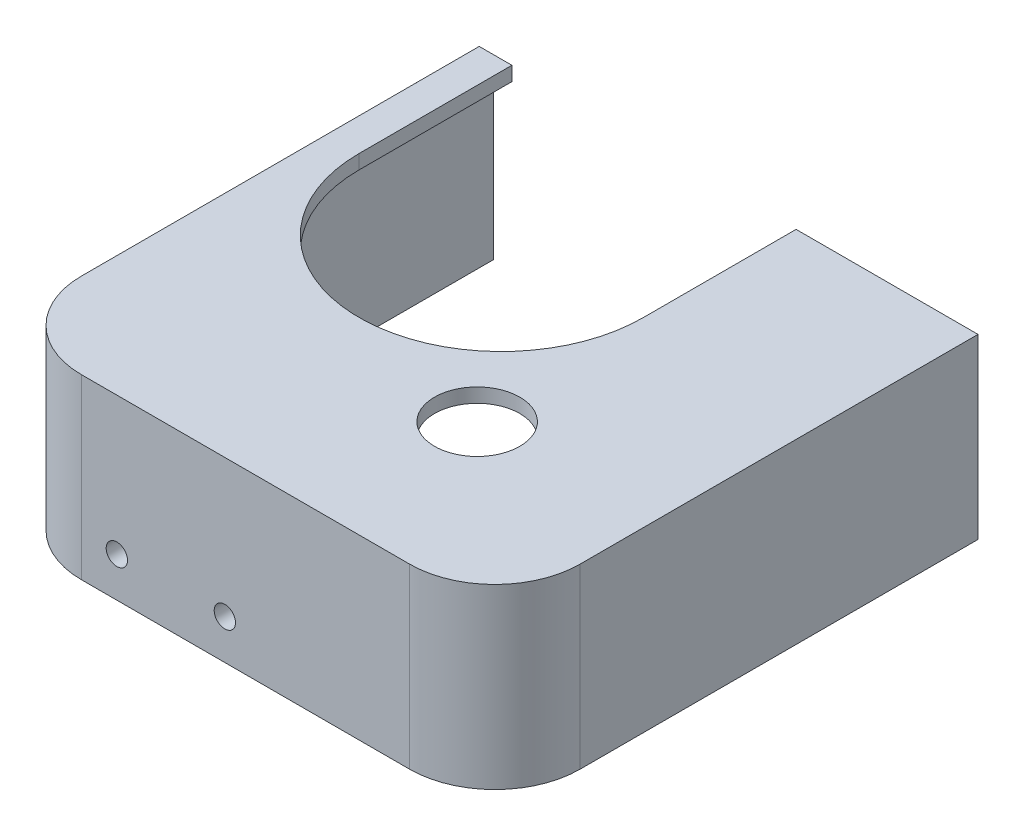
from build123d import *

# Parameters (mm, degrees)
SKETCH1_W             = 4.399513203
SKETCH1_H             = 6
SKETCH1_R             = 0.75
BOSS_EXTRUDE1_DEPTH   = 1.5
BOSS_EXTRUDE1_2_DEPTH = 1.5
BOSS_EXTRUDE2_START   = -1
SKETCH2_W             = 34.1
SKETCH2_H             = 12.5
SKETCH2_R             = 0.75
BOSS_EXTRUDE2_DEPTH   = 1
BOSS_EXTRUDE3_DEPTH   = 1
SKETCH5_W             = 34
SKETCH5_H             = 12.5
BOSS_EXTRUDE4_DEPTH   = 1
SKETCH6_W             = 34
SKETCH6_H             = 12.5
BOSS_EXTRUDE5_DEPTH   = 1
SKETCH7_W             = 3.200973594
SKETCH7_H             = 6
BOSS_EXTRUDE6_DEPTH   = 2
FILLET1_R             = 2
FILLET2_R             = 5
FILLET3_R             = 6
FILLET4_R             = 5
FILLET5_R             = 6
SKETCH8_R             = 3
CUT_EXTRUDE1_DEPTH    = 2
FILLET1_OF_MIRROR1_R  = 2
FILLET2_OF_MIRROR1_R  = 5
FILLET3_OF_MIRROR1_R  = 6
FILLET4_OF_MIRROR1_R  = 5
FILLET5_OF_MIRROR1_R  = 6
CUT_EXTRUDE2_START    = -10.5
CUT_EXTRUDE2_DEPTH    = 10.5
CUT_EXTRUDE4_START    = -1
CUT_EXTRUDE4_DEPTH    = 1


with BuildPart() as part:
    # Sketch1 → Boss-Extrude1 (new body)
    with BuildSketch(Plane.XY):
        with Locations((-6.699756601, -5)):
            Rectangle(SKETCH1_W, SKETCH1_H)
        with Locations((-6.7, -4.8)):
            Circle(SKETCH1_R, mode=Mode.SUBTRACT)
    boss_extrude1 = extrude(amount=BOSS_EXTRUDE1_DEPTH)



with BuildPart() as body_2:
    # Sketch1 → Boss-Extrude1 2 (new body)
    with BuildSketch(Plane.XY):
        with Locations((-14.300243399, -5)):
            Rectangle(SKETCH1_W, SKETCH1_H)
        with Locations((-14.3, -4.8)):
            Circle(SKETCH1_R, mode=Mode.SUBTRACT)
    boss_extrude1_2 = extrude(amount=BOSS_EXTRUDE1_2_DEPTH)


with BuildPart() as part_1:
    add(part.part)

    add(body_2.part)  # Boss-Extrude2 merges body 2
    # Sketch2 → Boss-Extrude2 (add)
    with BuildSketch(Plane.XY.offset(1.5).offset(BOSS_EXTRUDE2_START)):
        with Locations((-4.75, -8.25)):
            Rectangle(SKETCH2_W, SKETCH2_H)
        with Locations((-6.7, -4.8)):
            Circle(SKETCH2_R, mode=Mode.SUBTRACT)
        with Locations((-14.3, -4.8)):
            Circle(SKETCH2_R, mode=Mode.SUBTRACT)
    boss_extrude2 = extrude(amount=BOSS_EXTRUDE2_DEPTH)

    # Sketch4 → Boss-Extrude3 (add)
    with BuildSketch(Plane.XZ.offset(14.5)):
        with BuildLine():
            Line((-21.8, 0.5), (-21.8, -32.5))
            Line((-21.8, -32.5), (-20.5, -32.5))
            Line((-20.5, -32.5), (-20.5, -21.75))
            ThreePointArc((-20.5, -21.75), (-10.5, -11.75), (-0.5, -21.75))
            Line((-0.5, -21.75), (-0.5, -32.5))
            Line((-0.5, -32.5), (12.3, -32.5))
            Line((12.3, -32.5), (12.3, 0.5))
            Line((12.3, 0.5), (-21.8, 0.5))
        make_face()
    boss_extrude3 = extrude(amount=-BOSS_EXTRUDE3_DEPTH)

    # Sketch5 → Boss-Extrude4 (add)
    with BuildSketch(Plane.ZY.offset(21.8)):
        with Locations((-15.5, -8.25)):
            Rectangle(SKETCH5_W, SKETCH5_H)
    boss_extrude4 = extrude(amount=BOSS_EXTRUDE4_DEPTH)

    # Sketch6 → Boss-Extrude5 (add)
    with BuildSketch(Plane(origin=(12.3, 0, 0), x_dir=(0, 0, -1), z_dir=(1, 0, 0))):
        with Locations((15.5, -8.25)):
            Rectangle(SKETCH6_W, SKETCH6_H)
    boss_extrude5 = extrude(amount=-BOSS_EXTRUDE5_DEPTH)

    # Sketch7 → Boss-Extrude6 (add)
    with BuildSketch(Plane(origin=(0, 0, 0.5), x_dir=(-1, 0, 0), z_dir=(0, 0, -1))):
        with Locations((10.5, -5)):
            Rectangle(SKETCH7_W, SKETCH7_H)
    boss_extrude6 = extrude(amount=BOSS_EXTRUDE6_DEPTH)

    # Fillet1
    # the kernel refuses this fillet: 2 mm, written as the material it adds along each edge
    with BuildSketch(Plane(origin=(-16.5, -8, 0.5), x_dir=(0, 0, -1), z_dir=(1, 0, 0))) as fillet1_piece_1_section:
        with BuildLine():
            CenterArc((FILLET1_R, -FILLET1_R), FILLET1_R, 90, 90)
            Line((0, -FILLET1_R), (0, 0))
            Line((0, 0), (FILLET1_R, 0))
        make_face()
    fillet1_piece_1 = extrude(amount=12, mode=Mode.PRIVATE)
    fillet1_piece_1 = split(fillet1_piece_1, bisect_by=Plane(origin=(-14.300243398, -8.620266002, 0), z_dir=(0, 0, 1)), keep=Keep.TOP, mode=Mode.PRIVATE)
    fillet1_piece_1 = split(fillet1_piece_1, bisect_by=Plane(origin=(-12.100486797, -8.620266002, 0.317331321), z_dir=(-1, 0, 0)), keep=Keep.TOP, mode=Mode.PRIVATE)
    add(fillet1_piece_1)
    with BuildSketch(Plane(origin=(-16.5, -8, 0.5), x_dir=(0, 0, -1), z_dir=(1, 0, 0))) as fillet1_piece_2_section:
        with BuildLine():
            CenterArc((FILLET1_R, -FILLET1_R), FILLET1_R, 90, 90)
            Line((0, -FILLET1_R), (0, 0))
            Line((0, 0), (FILLET1_R, 0))
        make_face()
    fillet1_piece_2 = extrude(amount=12, mode=Mode.PRIVATE)
    fillet1_piece_2 = split(fillet1_piece_2, bisect_by=Plane(origin=(-8.899513203, -8.160707913, -0.423889575), z_dir=(-1, 0, 0)), keep=Keep.TOP, mode=Mode.PRIVATE)
    fillet1_piece_2 = split(fillet1_piece_2, bisect_by=Plane(origin=(-10.5, -8.160707913, 0), z_dir=(0, 0, -1)), keep=Keep.TOP, mode=Mode.PRIVATE)
    fillet1_piece_2 = split(fillet1_piece_2, bisect_by=Plane(origin=(-12.100486797, -8.160707913, -0.423889575), z_dir=(1, 0, 0)), keep=Keep.TOP, mode=Mode.PRIVATE)
    add(fillet1_piece_2)
    with BuildSketch(Plane(origin=(-16.5, -8, 0.5), x_dir=(0, 0, -1), z_dir=(1, 0, 0))) as fillet1_piece_3_section:
        with BuildLine():
            CenterArc((FILLET1_R, -FILLET1_R), FILLET1_R, 90, 90)
            Line((0, -FILLET1_R), (0, 0))
            Line((0, 0), (FILLET1_R, 0))
        make_face()
    fillet1_piece_3 = extrude(amount=12, mode=Mode.PRIVATE)
    fillet1_piece_3 = split(fillet1_piece_3, bisect_by=Plane(origin=(-8.899513203, -8.620266002, 0.317331321), z_dir=(-1, 0, 0)), keep=Keep.TOP, mode=Mode.PRIVATE)
    fillet1_piece_3 = split(fillet1_piece_3, bisect_by=Plane(origin=(-10.5, -8.620266002, 0), z_dir=(0, 0, 1)), keep=Keep.TOP, mode=Mode.PRIVATE)
    fillet1_piece_3 = split(fillet1_piece_3, bisect_by=Plane(origin=(-12.100486797, -8.620266002, 0.317331321), z_dir=(1, 0, 0)), keep=Keep.TOP, mode=Mode.PRIVATE)
    add(fillet1_piece_3)
    with BuildSketch(Plane(origin=(-16.5, -8, 0.5), x_dir=(0, 0, -1), z_dir=(1, 0, 0))) as fillet1_piece_4_section:
        with BuildLine():
            CenterArc((FILLET1_R, -FILLET1_R), FILLET1_R, 90, 90)
            Line((0, -FILLET1_R), (0, 0))
            Line((0, 0), (FILLET1_R, 0))
        make_face()
    fillet1_piece_4 = extrude(amount=12, mode=Mode.PRIVATE)
    fillet1_piece_4 = split(fillet1_piece_4, bisect_by=Plane(origin=(-8.899513203, -8.620266002, 0.317331321), z_dir=(1, 0, 0)), keep=Keep.TOP, mode=Mode.PRIVATE)
    fillet1_piece_4 = split(fillet1_piece_4, bisect_by=Plane(origin=(-6.699756602, -8.620266002, 0), z_dir=(0, 0, 1)), keep=Keep.TOP, mode=Mode.PRIVATE)
    add(fillet1_piece_4)

    # Fillet2
    fillet2_edges = [part_1.edges().sort_by_distance(p)[0] for p in [
        (-21.8, -7.75, 0.5),
    ]]
    fillet(fillet2_edges, radius=FILLET2_R)

    # Fillet3
    fillet3_edges = [part_1.edges().sort_by_distance(p)[0] for p in [
        (-22.8, -8.25, 1.5),
    ]]
    fillet(fillet3_edges, radius=FILLET3_R)

    # Fillet4
    fillet4_edges = [part_1.edges().sort_by_distance(p)[0] for p in [
        (11.3, -7.75, 0.5),
    ]]
    fillet(fillet4_edges, radius=FILLET4_R)

    # Fillet5
    fillet5_edges = [part_1.edges().sort_by_distance(p)[0] for p in [
        (12.3, -8.25, 1.5),
    ]]
    fillet(fillet5_edges, radius=FILLET5_R)

    # Sketch8 → Cut-Extrude1 (cut)
    with BuildSketch(Plane(origin=(0, -13.5, 0), x_dir=(1, 0, 0), z_dir=(0, 1, 0))):
        with Locations(Location((0, 9.555, 0), (0, 0, 270))):
            Circle(SKETCH8_R)
    cut_extrude1 = extrude(amount=-CUT_EXTRUDE1_DEPTH, mode=Mode.SUBTRACT)

    # Mirror1: Boss-Extrude1, Boss-Extrude1 2, Boss-Extrude2, Boss-Extrude3, Boss-Extrude4, Boss-Extrude5, Boss-Extrude6, Cut-Extrude1 across plane
    add(boss_extrude1.mirror(Plane(origin=(-10.5, -13.5, -21.75), x_dir=(0, 0, 1), z_dir=(0, -1, 0))))
    add(boss_extrude1_2.mirror(Plane(origin=(-10.5, -13.5, -21.75), x_dir=(0, 0, 1), z_dir=(0, -1, 0))))
    add(boss_extrude2.mirror(Plane(origin=(-10.5, -13.5, -21.75), x_dir=(0, 0, 1), z_dir=(0, -1, 0))))
    add(boss_extrude3.mirror(Plane(origin=(-10.5, -13.5, -21.75), x_dir=(0, 0, 1), z_dir=(0, -1, 0))))
    add(boss_extrude4.mirror(Plane(origin=(-10.5, -13.5, -21.75), x_dir=(0, 0, 1), z_dir=(0, -1, 0))))
    add(boss_extrude5.mirror(Plane(origin=(-10.5, -13.5, -21.75), x_dir=(0, 0, 1), z_dir=(0, -1, 0))))
    add(boss_extrude6.mirror(Plane(origin=(-10.5, -13.5, -21.75), x_dir=(0, 0, 1), z_dir=(0, -1, 0))))
    add(cut_extrude1.mirror(Plane(origin=(-10.5, -13.5, -21.75), x_dir=(0, 0, 1), z_dir=(0, -1, 0))), mode=Mode.SUBTRACT)

    # Fillet1 of Mirror1
    # the kernel refuses this fillet: 2 mm, written as the material it adds along each edge
    with BuildSketch(Plane(origin=(-4.5, -19, 0.5), x_dir=(0, 1, 0), z_dir=(-1, 0, 0))) as fillet1_of_mirror1_piece_1_section:
        with BuildLine():
            CenterArc((FILLET1_OF_MIRROR1_R, FILLET1_OF_MIRROR1_R), FILLET1_OF_MIRROR1_R, 180, 90)
            Line((0, FILLET1_OF_MIRROR1_R), (0, 0))
            Line((0, 0), (FILLET1_OF_MIRROR1_R, 0))
        make_face()
    fillet1_of_mirror1_piece_1 = extrude(amount=12, mode=Mode.PRIVATE)
    fillet1_of_mirror1_piece_1 = split(fillet1_of_mirror1_piece_1, bisect_by=Plane(origin=(-6.699756602, -18.379733998, 0), z_dir=(0, 0, 1)), keep=Keep.TOP, mode=Mode.PRIVATE)
    fillet1_of_mirror1_piece_1 = split(fillet1_of_mirror1_piece_1, bisect_by=Plane(origin=(-8.899513203, -18.379733998, 0.317331321), z_dir=(1, 0, 0)), keep=Keep.TOP, mode=Mode.PRIVATE)
    add(fillet1_of_mirror1_piece_1)
    with BuildSketch(Plane(origin=(-4.5, -19, 0.5), x_dir=(0, 1, 0), z_dir=(-1, 0, 0))) as fillet1_of_mirror1_piece_2_section:
        with BuildLine():
            CenterArc((FILLET1_OF_MIRROR1_R, FILLET1_OF_MIRROR1_R), FILLET1_OF_MIRROR1_R, 180, 90)
            Line((0, FILLET1_OF_MIRROR1_R), (0, 0))
            Line((0, 0), (FILLET1_OF_MIRROR1_R, 0))
        make_face()
    fillet1_of_mirror1_piece_2 = extrude(amount=12, mode=Mode.PRIVATE)
    fillet1_of_mirror1_piece_2 = split(fillet1_of_mirror1_piece_2, bisect_by=Plane(origin=(-10.5, -18.379733998, 0), z_dir=(0, 0, 1)), keep=Keep.TOP, mode=Mode.PRIVATE)
    fillet1_of_mirror1_piece_2 = split(fillet1_of_mirror1_piece_2, bisect_by=Plane(origin=(-12.100486797, -18.379733998, 0.317331321), z_dir=(1, 0, 0)), keep=Keep.TOP, mode=Mode.PRIVATE)
    fillet1_of_mirror1_piece_2 = split(fillet1_of_mirror1_piece_2, bisect_by=Plane(origin=(-8.899513203, -18.379733998, 0.317331321), z_dir=(-1, 0, 0)), keep=Keep.TOP, mode=Mode.PRIVATE)
    add(fillet1_of_mirror1_piece_2)
    with BuildSketch(Plane(origin=(-4.5, -19, 0.5), x_dir=(0, 1, 0), z_dir=(-1, 0, 0))) as fillet1_of_mirror1_piece_3_section:
        with BuildLine():
            CenterArc((FILLET1_OF_MIRROR1_R, FILLET1_OF_MIRROR1_R), FILLET1_OF_MIRROR1_R, 180, 90)
            Line((0, FILLET1_OF_MIRROR1_R), (0, 0))
            Line((0, 0), (FILLET1_OF_MIRROR1_R, 0))
        make_face()
    fillet1_of_mirror1_piece_3 = extrude(amount=12, mode=Mode.PRIVATE)
    fillet1_of_mirror1_piece_3 = split(fillet1_of_mirror1_piece_3, bisect_by=Plane(origin=(-10.5, -18.839292087, 0), z_dir=(0, 0, -1)), keep=Keep.TOP, mode=Mode.PRIVATE)
    fillet1_of_mirror1_piece_3 = split(fillet1_of_mirror1_piece_3, bisect_by=Plane(origin=(-12.100486797, -18.839292087, -0.423889575), z_dir=(1, 0, 0)), keep=Keep.TOP, mode=Mode.PRIVATE)
    fillet1_of_mirror1_piece_3 = split(fillet1_of_mirror1_piece_3, bisect_by=Plane(origin=(-8.899513203, -18.839292087, -0.423889575), z_dir=(-1, 0, 0)), keep=Keep.TOP, mode=Mode.PRIVATE)
    add(fillet1_of_mirror1_piece_3)
    with BuildSketch(Plane(origin=(-4.5, -19, 0.5), x_dir=(0, 1, 0), z_dir=(-1, 0, 0))) as fillet1_of_mirror1_piece_4_section:
        with BuildLine():
            CenterArc((FILLET1_OF_MIRROR1_R, FILLET1_OF_MIRROR1_R), FILLET1_OF_MIRROR1_R, 180, 90)
            Line((0, FILLET1_OF_MIRROR1_R), (0, 0))
            Line((0, 0), (FILLET1_OF_MIRROR1_R, 0))
        make_face()
    fillet1_of_mirror1_piece_4 = extrude(amount=12, mode=Mode.PRIVATE)
    fillet1_of_mirror1_piece_4 = split(fillet1_of_mirror1_piece_4, bisect_by=Plane(origin=(-14.300243398, -18.379733998, 0), z_dir=(0, 0, 1)), keep=Keep.TOP, mode=Mode.PRIVATE)
    fillet1_of_mirror1_piece_4 = split(fillet1_of_mirror1_piece_4, bisect_by=Plane(origin=(-12.100486797, -18.379733998, 0.317331321), z_dir=(-1, 0, 0)), keep=Keep.TOP, mode=Mode.PRIVATE)
    add(fillet1_of_mirror1_piece_4)

    # Fillet2 of Mirror1
    fillet2_of_mirror1_edges = [part_1.edges().sort_by_distance(p)[0] for p in [
        (-21.8, -19.25, 0.5),
    ]]
    fillet(fillet2_of_mirror1_edges, radius=FILLET2_OF_MIRROR1_R)

    # Fillet3 of Mirror1
    fillet3_of_mirror1_edges = [part_1.edges().sort_by_distance(p)[0] for p in [
        (-22.8, -18.75, 1.5),
    ]]
    fillet(fillet3_of_mirror1_edges, radius=FILLET3_OF_MIRROR1_R)

    # Fillet4 of Mirror1
    fillet4_of_mirror1_edges = [part_1.edges().sort_by_distance(p)[0] for p in [
        (11.3, -19.25, 0.5),
    ]]
    fillet(fillet4_of_mirror1_edges, radius=FILLET4_OF_MIRROR1_R)

    # Fillet5 of Mirror1
    fillet5_of_mirror1_edges = [part_1.edges().sort_by_distance(p)[0] for p in [
        (12.3, -18.75, 1.5),
    ]]
    fillet(fillet5_of_mirror1_edges, radius=FILLET5_OF_MIRROR1_R)

    # Sketch9 → Cut-Extrude2 (cut)
    with BuildSketch(Plane(origin=(0, -2, 0), x_dir=(1, 0, 0), z_dir=(0, 1, 0)).offset(CUT_EXTRUDE2_START)):
        with BuildLine():
            Line((-16.8, -1.5), (6.3, -1.5))
            ThreePointArc((6.3, -1.5), (10.542640687, 0.257359313), (12.3, 4.5))
            Line((12.3, 4.5), (12.3, 32.5))
            Line((12.3, 32.5), (11.3, 32.5))
            Line((11.3, 32.5), (11.3, 4.5))
            ThreePointArc((11.3, 4.5), (9.835533906, 0.964466094), (6.3, -0.5))
            Line((6.3, -0.5), (-4.5, -0.5))
            Line((-4.5, -0.5), (-4.5, 0))
            Line((-4.5, 0), (-8.899513203, 0))
            Line((-8.899513203, 0), (-8.899513203, 1.5))
            Line((-8.899513203, 1.5), (-12.100486797, 1.5))
            Line((-12.100486797, 1.5), (-12.100486797, 0))
            Line((-12.100486797, 0), (-16.5, 0))
            Line((-16.5, 0), (-16.5, -0.5))
            Line((-16.5, -0.5), (-16.8, -0.5))
            ThreePointArc((-16.8, -0.5), (-20.335533906, 0.964466094), (-21.8, 4.5))
            Line((-21.8, 4.5), (-21.8, 32.5))
            Line((-21.8, 32.5), (-22.8, 32.5))
            Line((-22.8, 32.5), (-22.8, 4.5))
            ThreePointArc((-22.8, 4.5), (-21.042640687, 0.257359313), (-16.8, -1.5))
        make_face()
    extrude(amount=CUT_EXTRUDE2_DEPTH, mode=Mode.SUBTRACT)

    # Sketch12 → Cut-Extrude4 (cut)
    with BuildSketch(Plane.XZ.offset(14.5).offset(CUT_EXTRUDE4_START)):
        with BuildLine():
            Line((-21.8, -4.5), (-21.8, -32.5))
            Line((-21.8, -32.5), (-20.5, -32.5))
            Line((-20.5, -32.5), (-20.5, -21.75))
            ThreePointArc((-20.5, -21.75), (-10.5, -11.75), (-0.5, -21.75))
            Line((-0.5, -21.75), (-0.5, -32.5))
            Line((-0.5, -32.5), (11.3, -32.5))
            Line((11.3, -32.5), (11.3, -4.5))
            ThreePointArc((11.3, -4.5), (9.835533906, -0.964466094), (6.3, 0.5))
            Line((6.3, 0.5), (-16.8, 0.5))
            ThreePointArc((-16.8, 0.5), (-20.335533906, -0.964466094), (-21.8, -4.5))
        make_face()
    extrude(amount=CUT_EXTRUDE4_DEPTH, mode=Mode.SUBTRACT)


solid = part_1.part
